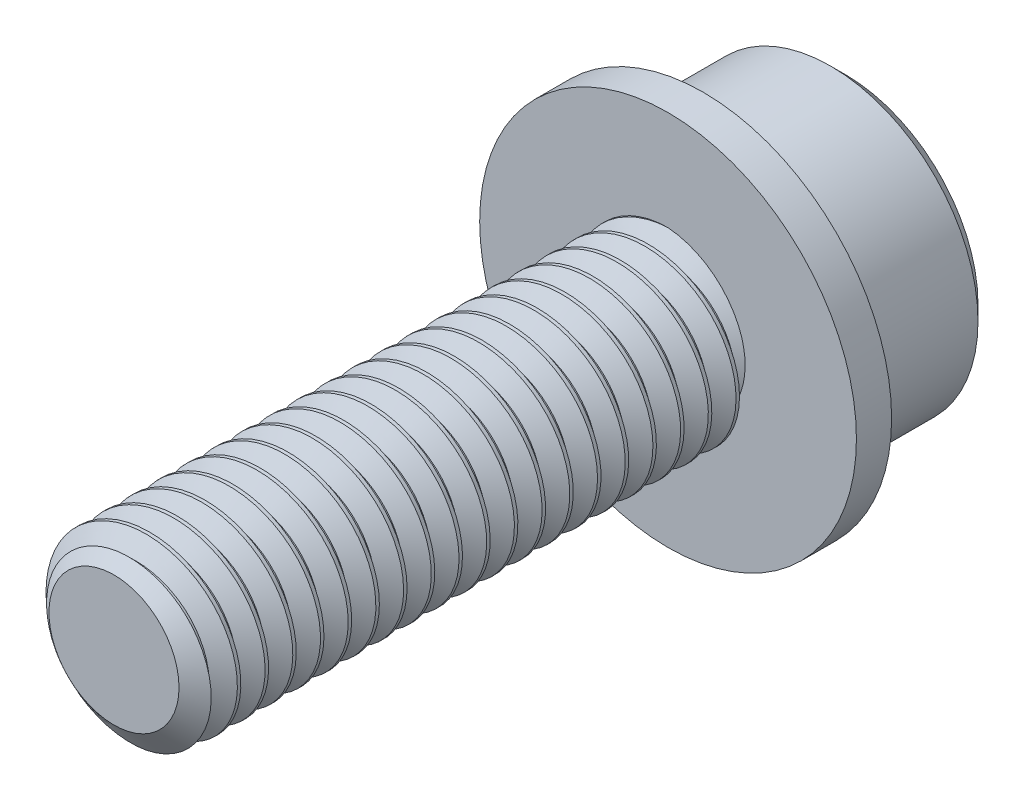
from build123d import *

# Parameters (mm, degrees)
SKETCH1_R           = 4
EXTRUDE1_DEPTH      = 25
CUT_SWEEP1_PITCH    = 1.25
SKETCH6_R           = 6.65
EXTRUDE2_DEPTH      = 8
SKETCH10_R          = 8.5
BOSS_EXTRUDE1_DEPTH = 1.5875
CUT_EXTRUDE1_DEPTH  = 4.5
CHAMFER1_SIZE       = 0.665
FILLET1_R           = 0.396875


with BuildPart() as part:
    # Sketch1 → Extrude1 (new body)
    with BuildSketch(Plane.XY):
        Circle(SKETCH1_R)
    extrude(amount=-EXTRUDE1_DEPTH)

    # Cut-Sweep1: the profile of Sketch3 profile screwed along a right-hand helix of 21 turns, 6 arcs to a turn; built about Z, then put on its axis
    cut_sweep1_z = Axis((0, 0, 0), (0, 0, 1))
    cut_sweep1_corners = [(4.0003, 0, -1.093923205), (3.188101184, 0, -0.625), (3.188101184, 0, -0.46875), (4.0003, 0, 0.000173205)]
    with BuildLine(mode=Mode.PRIVATE) as cut_sweep1_profile:
        Line(cut_sweep1_corners[0], cut_sweep1_corners[1])
        Line(cut_sweep1_corners[1], cut_sweep1_corners[2])
        Line(cut_sweep1_corners[2], cut_sweep1_corners[3])
        Line(cut_sweep1_corners[3], cut_sweep1_corners[0])
    cut_sweep1_cap = Face(cut_sweep1_profile.wire())
    cut_sweep1_turn_angles = [0, 30, 60, 90, 120, 150, 180, 210, 240, 270, 300, 330, 360]
    cut_sweep1_turn_weights = [1, 0.8660254037844387, 1, 0.8660254037844387, 1, 0.8660254037844387, 1, 0.8660254037844387, 1, 0.8660254037844387, 1, 0.8660254037844387, 1]
    cut_sweep1_turn_rails = [Edge.make_bspline([Vector(p[0], p[1], 0).rotate(cut_sweep1_z, cut_sweep1_turn_angles[k]) / cut_sweep1_turn_weights[k] + Vector(0, 0, p[2] + CUT_SWEEP1_PITCH * cut_sweep1_turn_angles[k] / 360) for k in range(13)], [0, 0, 0, 1, 1, 2, 2, 3, 3, 4, 4, 5, 5, 6, 6, 6], 2, cut_sweep1_turn_weights) for p in cut_sweep1_corners]
    cut_sweep1_turn_sides = [Face.make_surface_from_curves(cut_sweep1_turn_rails[p[0]], cut_sweep1_turn_rails[p[1]]) for p in [(0, 1), (1, 2), (2, 3), (3, 0)]]
    cut_sweep1 = Plane(origin=(0, 0, 0), x_dir=(0, 1, 0), z_dir=(0, 0, -1)) * Solid(Shell([*[p.moved(Location((0, 0, CUT_SWEEP1_PITCH * i))) for i in range(21) for p in cut_sweep1_turn_sides], cut_sweep1_cap, cut_sweep1_cap.rotate(cut_sweep1_z, 7560).moved(Location((0, 0, CUT_SWEEP1_PITCH * 7560 / 360)))]))
    add(cut_sweep1, mode=Mode.SUBTRACT)

    # Sketch4 → Cut-Revolve1 (revolve, cut)
    with BuildSketch(Plane(origin=(0, 0, 0), x_dir=(0, 0, -1), z_dir=(1, 0, 0)), mode=Mode.PRIVATE) as cut_revolve1_sk:
        Polygon((0.746350386, 4), (0, 2.934101184), (0, 4), align=None)
    revolve(cut_revolve1_sk.sketch.rotate(Axis((0, 0, 0), (0, 0, -1)), 90), axis=Axis((0, 0, 0), (0, 0, -1)), mode=Mode.SUBTRACT)

    # Sketch6 → Extrude2 (add)
    with BuildSketch(Plane(origin=(0, 0, -25), x_dir=(-1, 0, 0), z_dir=(0, 0, -1))):
        with Locations(Location((0, 0, 0), (0, 0, 180))):
            Circle(SKETCH6_R)
    extrude(amount=EXTRUDE2_DEPTH)

    # Sketch10 → Boss-Extrude1 (add)
    with BuildSketch(Plane.XY.offset(-25)):
        Circle(SKETCH10_R)
    extrude(amount=-BOSS_EXTRUDE1_DEPTH)

    # Sketch7 → Cut-Extrude1 (cut)
    with BuildSketch(Plane(origin=(0, 0, -33), x_dir=(-1, 0, 0), z_dir=(0, 0, -1))):
        Polygon((0, 3.464101615), (-3, 1.732050808), (-3, -1.732050808), (0, -3.464101615), (3, -1.732050808), (3, 1.732050808), align=None)
    extrude(amount=-CUT_EXTRUDE1_DEPTH, mode=Mode.SUBTRACT)

    # Cut-Extrude2 cone 1 section (through the dimple's axis) → Cut-Extrude2 (revolve, cut)
    with BuildSketch(Plane(origin=(0, 0, -33), x_dir=(0, 1, 0), z_dir=(1, 0, 0))):
        Polygon((0, 0), (3.464101615, 0), (0, 3.464101615), align=None)
    revolve(axis=Axis((0, 0, -33), (0, 0, 1)), mode=Mode.SUBTRACT)

    # Chamfer1
    chamfer1_edges = [part.edges().sort_by_distance(p)[0] for p in [
        (-6.65, 0, -33),
    ]]
    chamfer(chamfer1_edges, length=CHAMFER1_SIZE)

    # Fillet1
    fillet1_edges = [part.edges().sort_by_distance(p)[0] for p in [
        (-6.65, 0, -26.5875),
    ]]
    fillet(fillet1_edges, radius=FILLET1_R)


solid = part.part
